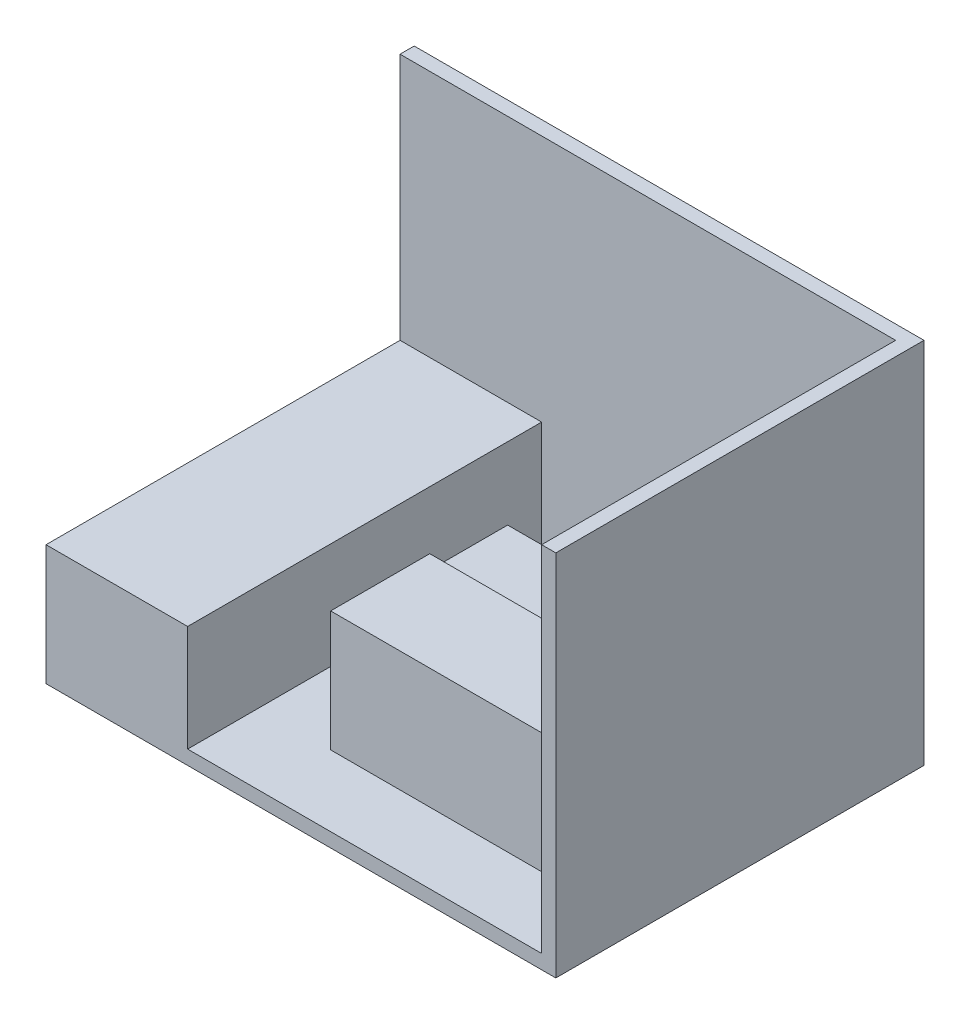
from build123d import *

# Parameters (mm, degrees)
SKETCH1_W           = 3600
SKETCH1_H           = 2600
BOSS_EXTRUDE1_DEPTH = 100
BOSS_EXTRUDE2_DEPTH = 2500
SKETCH4_W           = 2000
SKETCH4_H           = 700
BOSS_EXTRUDE3_DEPTH = 850
SKETCH5_W           = 1000
SKETCH5_H           = 2500
BOSS_EXTRUDE4_DEPTH = 750
SKETCH6_W           = 1000
SKETCH6_H           = 500
BOSS_EXTRUDE5_DEPTH = 750


with BuildPart() as part:
    # Sketch1 → Boss-Extrude1 (new body)
    with BuildSketch(Plane(origin=(0, 0, 0), x_dir=(1, 0, 0), z_dir=(0, 1, 0))):
        with Locations((-446.376811594, -227.536231884)):
            Rectangle(SKETCH1_W, SKETCH1_H)
    extrude(amount=BOSS_EXTRUDE1_DEPTH)

    # Sketch2 → Boss-Extrude2 (add)
    with BuildSketch(Plane(origin=(0, 100, 0), x_dir=(1, 0, 0), z_dir=(0, 1, 0))):
        Polygon((1353.623188406, -1527.536231884), (1253.623188406, -1527.536231884), (1253.623188406, 972.463768116), (-2246.376811594, 972.463768116), (-2246.376811594, 1072.463768116), (1353.623188406, 1072.463768116), align=None)
    extrude(amount=BOSS_EXTRUDE2_DEPTH)

    # Sketch4 → Boss-Extrude3 (add)
    with BuildSketch(Plane(origin=(0, 100, 0), x_dir=(1, 0, 0), z_dir=(0, 1, 0))):
        with Locations((263.623188406, -677.536231884)):
            Rectangle(SKETCH4_W, SKETCH4_H)
    extrude(amount=BOSS_EXTRUDE3_DEPTH)

    # Sketch5 → Boss-Extrude4 (add)
    with BuildSketch(Plane(origin=(0, 100, 0), x_dir=(1, 0, 0), z_dir=(0, 1, 0))):
        with Locations((-1746.376811594, -277.536231884)):
            Rectangle(SKETCH5_W, SKETCH5_H)
    extrude(amount=BOSS_EXTRUDE4_DEPTH)

    # Sketch6 → Boss-Extrude5 (add)
    with BuildSketch(Plane(origin=(0, 100, 0), x_dir=(1, 0, 0), z_dir=(0, 1, 0))):
        with Locations((-236.376811594, -27.536231884)):
            Rectangle(SKETCH6_W, SKETCH6_H)
    extrude(amount=BOSS_EXTRUDE5_DEPTH)


solid = part.part
